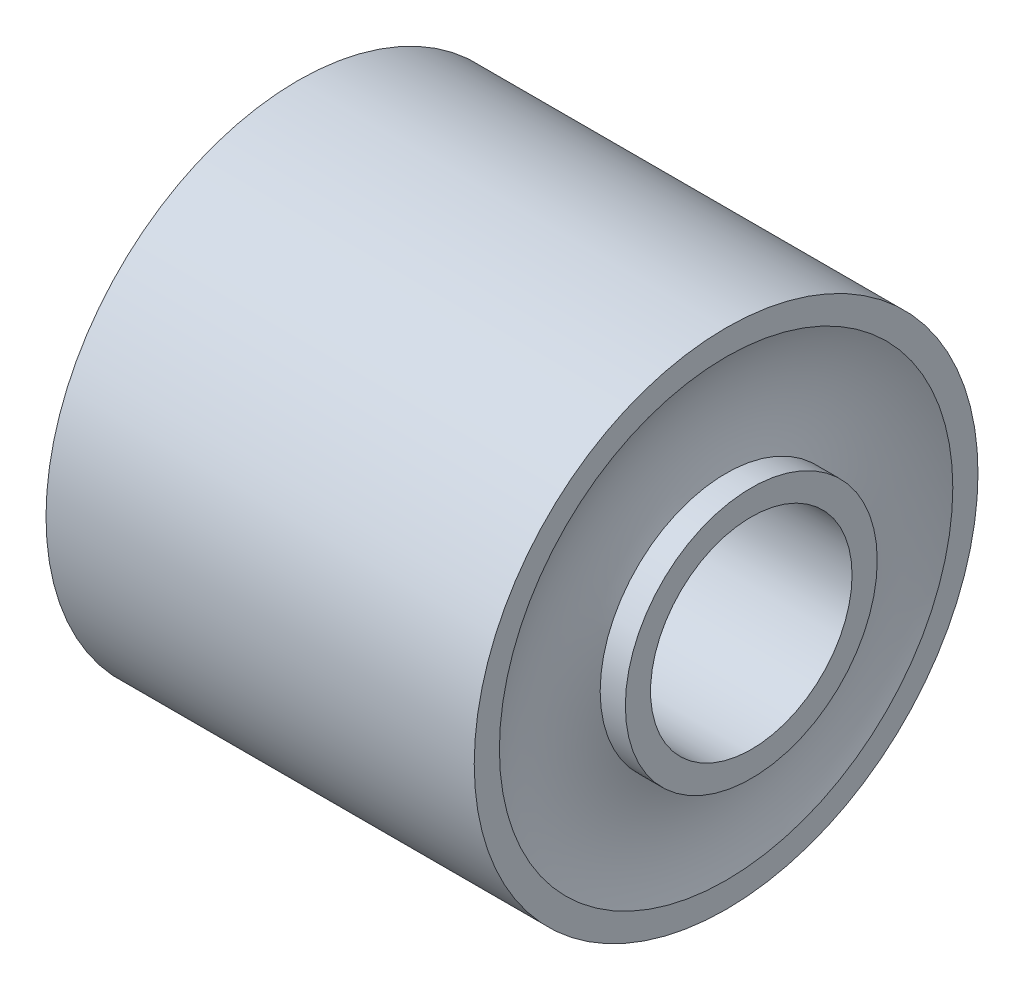
from build123d import *

# Parameters (mm, degrees)
SZKIC1_R                    = 5
SZKIC1_R_2                  = 4
DODANIE_WYCI_GNI_CIE1_DEPTH = 9.5
SZKIC2_R                    = 10
SZKIC2_R_2                  = 9
DODANIE_WYCI_GNI_CIE2_DEPTH = 8.5


with BuildPart() as part:
    # Szkic1 → Dodanie-wyciągnięcie1 (new, symmetric)
    with BuildSketch(Plane(origin=(0, 0, 0), x_dir=(0, 0, -1), z_dir=(1, 0, 0))):
        Circle(SZKIC1_R)
        Circle(SZKIC1_R_2, mode=Mode.SUBTRACT)
    extrude(amount=DODANIE_WYCI_GNI_CIE1_DEPTH, both=True)


with BuildPart() as body_2:
    # Szkic2 → Dodanie-wyciągnięcie2 (new, symmetric)
    with BuildSketch(Plane(origin=(0, 0, 0), x_dir=(0, 0, -1), z_dir=(1, 0, 0))):
        Circle(SZKIC2_R)
        Circle(SZKIC2_R_2, mode=Mode.SUBTRACT)
    extrude(amount=DODANIE_WYCI_GNI_CIE2_DEPTH, both=True)


with BuildPart() as body_3:
    # Szkic3 → Obrót1 (revolve)
    with BuildSketch(Plane.XY):
        with BuildLine():
            Line((-8.5, 9), (8.5, 9))
            ThreePointArc((8.5, 9), (8.082575695, 7), (8.5, 5))
            Line((8.5, 5), (-8.5, 5))
            ThreePointArc((-8.5, 5), (-8.082575695, 7), (-8.5, 9))
        make_face()
    revolve(axis=Axis((-9.5, 0, 0), (1, 0, 0)))


solid = Compound([part.part, body_2.part, body_3.part])
